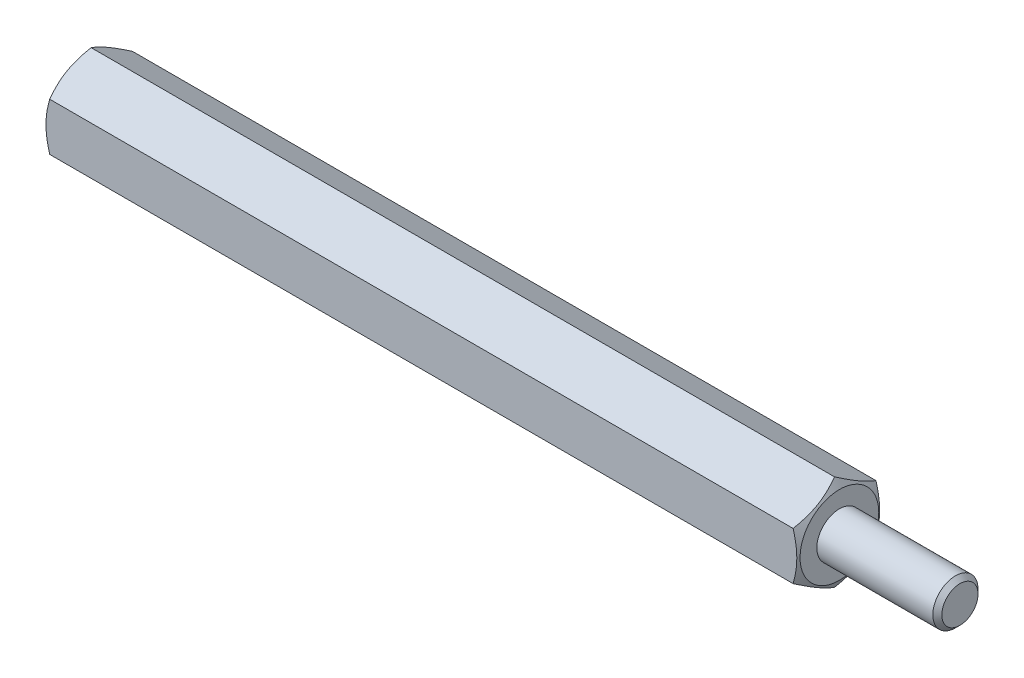
from build123d import *

# Parameters (mm, degrees)
BOSS_EXTRUDE1_DEPTH = 50
SKETCH2_R           = 1.5
BOSS_EXTRUDE2_DEPTH = 8
SKETCH3_R           = 1.5
CUT_EXTRUDE1_DEPTH  = 40
CHAMFER1_SIZE       = 0.3


with BuildPart() as part:
    # Sketch1 → Boss-Extrude1 (new body)
    with BuildSketch(Plane(origin=(0, 0, 0), x_dir=(0, 0, -1), z_dir=(1, 0, 0))):
        Polygon((0, 3.175426481), (-2.75, 1.58771324), (-2.75, -1.58771324), (0, -3.175426481), (2.75, -1.58771324), (2.75, 1.58771324), align=None)
    extrude(amount=BOSS_EXTRUDE1_DEPTH)

    # Sketch2 → Boss-Extrude2 (add)
    with BuildSketch(Plane(origin=(50, 0, 0), x_dir=(0, 0, -1), z_dir=(1, 0, 0))):
        Circle(SKETCH2_R)
    extrude(amount=BOSS_EXTRUDE2_DEPTH)

    # Sketch3 → Cut-Extrude1 (cut)
    with BuildSketch(Plane.ZY):
        Circle(SKETCH3_R)
    extrude(amount=-CUT_EXTRUDE1_DEPTH, mode=Mode.SUBTRACT)

    # Sketch4 → Cut-Revolve1 (revolve, cut)
    with BuildSketch(Plane(origin=(0, 0, 0), x_dir=(1, 0, 0), z_dir=(0, 1, 0))):
        Polygon((0, 10.219809024), (0, 2.6125), (4.392081913, 10.219809024), align=None)
        Polygon((45.607918087, 10.219809024), (50, 2.6125), (50, 10.219809024), align=None)
    revolve(axis=Axis((0, 0, 0), (-1, 0, 0)), mode=Mode.SUBTRACT)

    # Chamfer1
    chamfer1_edges = [part.edges().sort_by_distance(p)[0] for p in [
        (58, 0, 1.5),
    ]]
    chamfer(chamfer1_edges, length=CHAMFER1_SIZE)


solid = part.part
